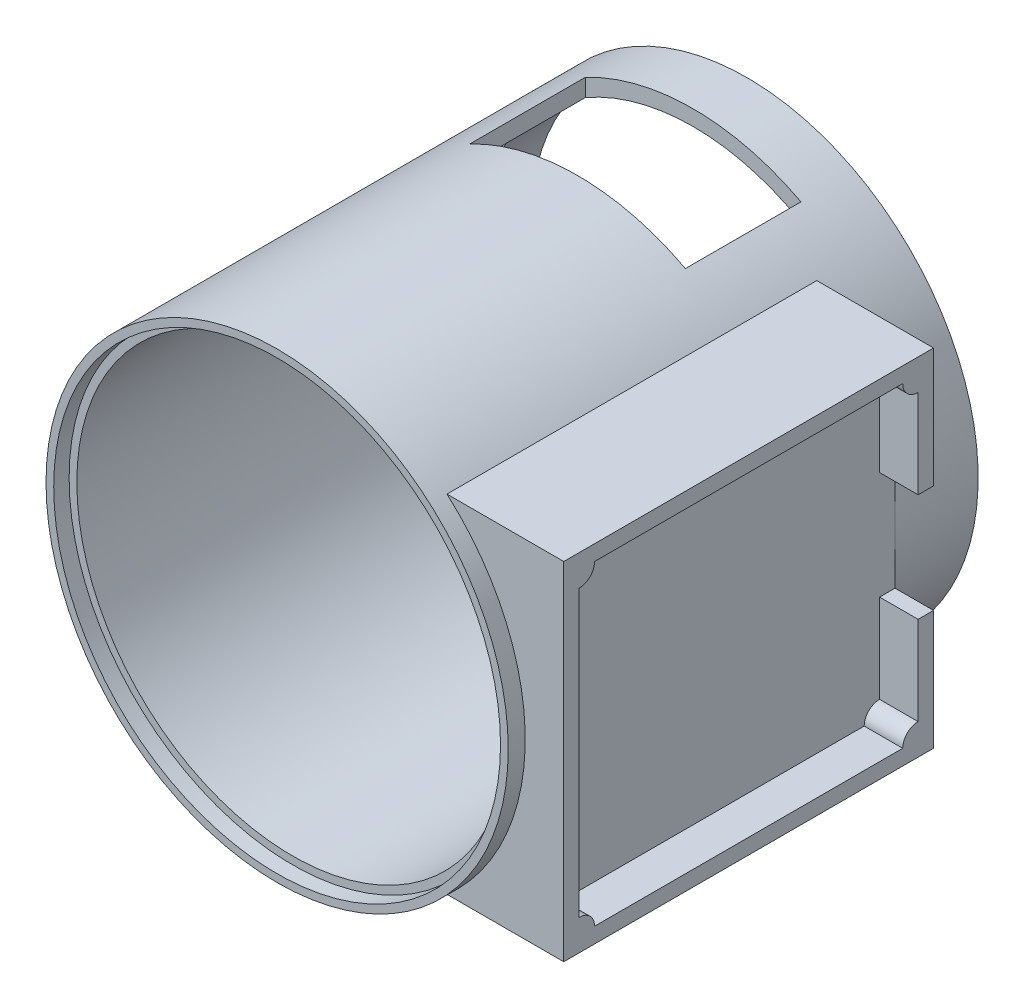
from build123d import *
from build123d.topology import SkipClean

# Parameters (mm, degrees)
SKETCH_1_R               = 30
SKETCH_1_R_2             = 28
EXTRUDE_1_DEPTH          = 2
SKETCH_2_R               = 30
SKETCH_2_R_2             = 28
EXTRUDE_2_DEPTH          = 52
CUT_EXTRUDE_START        = -2
SKETCH_6_R               = 29
SKETCH_6_R_2             = 28
CUT_EXTRUDE_2_DEPTH      = 2
EXTRUDE_START            = 7
SKETCH_7_R               = 30
SKETCH_7_R_2             = 28
EXTRUDE_3_DEPTH          = 7
EXTRUDE_7_REACH          = 88.116
EXTRUDE_7_END_RADIUS     = 30
SKETCH_8_W               = 48
SKETCH_8_H               = 45
SKETCH_9_W               = 28
SKETCH_9_H               = 15
CUT_EXTRUDE_3_DEPTH      = 69.673138854
PATTERN_CIRCULAR_2_COUNT = 3
PATTERN_CIRCULAR_2_ANGLE = 180
EXTRUDE_8_DEPTH          = 5


with BuildPart() as part:
    # 草图1 → 凸台-拉伸1 (new body)
    with BuildSketch(Plane.XY):
        Circle(SKETCH_1_R)
        Circle(SKETCH_1_R_2, mode=Mode.SUBTRACT)
    extrude(amount=EXTRUDE_1_DEPTH)

    # 草图2 → 凸台-拉伸2 (add)
    with BuildSketch(Plane.XY.offset(2)):
        Circle(SKETCH_2_R)
        Circle(SKETCH_2_R_2, mode=Mode.SUBTRACT)
    extrude(amount=EXTRUDE_2_DEPTH)

    # 草图6 → 切除-拉伸2 (cut)
    with BuildSketch(Plane.XY.offset(54).offset(CUT_EXTRUDE_START)):
        Circle(SKETCH_6_R)
        Circle(SKETCH_6_R_2, mode=Mode.SUBTRACT)
    extrude(amount=CUT_EXTRUDE_2_DEPTH, mode=Mode.SUBTRACT)

    # 草图7 → 凸台-拉伸3 (add)
    with SkipClean():  # the faces are left unmerged after this step: merging them gives an invalid solid
        with BuildSketch(Plane(origin=(0, 0, 0), x_dir=(-1, 0, 0), z_dir=(0, 0, -1)).offset(EXTRUDE_START)):
            Circle(SKETCH_7_R)
            Circle(SKETCH_7_R_2, mode=Mode.SUBTRACT)
        extrude(amount=-EXTRUDE_3_DEPTH)

    # 凸台-拉伸7: up to this cylinder (the profile starts outside it)
    with SkipClean():  # the faces are left unmerged after this step: merging them gives an invalid solid
        extrude_7_end = Plane(origin=(0, 0, 27.794079), z_dir=(0, 0, -1)) * Cylinder(EXTRUDE_7_END_RADIUS, 237.232, mode=Mode.PRIVATE)
        # 草图8 → 凸台-拉伸7 (add, up to the surface)
        with BuildSketch(Plane(origin=(30, 0, 0), x_dir=(0, 0, -1), z_dir=(1, 0, 0)), mode=Mode.PRIVATE) as extrude_7_sk1:
            with Locations((-27.794078809, 0)):
                Rectangle(SKETCH_8_W, SKETCH_8_H)
        extrude_7_tool1 = extrude(extrude_7_sk1.sketch, amount=-EXTRUDE_7_REACH, mode=Mode.PRIVATE) - extrude_7_end
        add(extrude_7_tool1.solids().sort_by_distance((30, 0, 27.794079))[0])
        add(extrude_7_tool1.solids().sort_by_distance((30, 0, 27.794079))[1])

    # 草图9 → 切除-拉伸3 (cut, through all)
    with SkipClean():  # the faces are left unmerged after this step: merging them gives an invalid solid
        with BuildSketch(Plane(origin=(0, 0, 0), x_dir=(1, 0, 0), z_dir=(0, 1, 0))):
            with Locations((0, -7.5)):
                Rectangle(SKETCH_9_W, SKETCH_9_H)
        cut_extrude_3 = extrude(amount=-CUT_EXTRUDE_3_DEPTH, mode=Mode.SUBTRACT)

    # 阵列(圆周)2: 切除-拉伸3 ×3 about axis
    with SkipClean():  # the faces are left unmerged after this step: merging them gives an invalid solid
        pattern_circular_2_axis = Axis((0, 0, 0), (0, 0, -1))
        for i in range(1, PATTERN_CIRCULAR_2_COUNT):
            add(cut_extrude_3.rotate(pattern_circular_2_axis, i * PATTERN_CIRCULAR_2_ANGLE / (PATTERN_CIRCULAR_2_COUNT - 1)), mode=Mode.SUBTRACT)

    # 草图10 → 凸台-拉伸8 (add)
    with SkipClean():  # the faces are left unmerged after this step: merging them gives an invalid solid
        with BuildSketch(Plane(origin=(30, 0, 0), x_dir=(0, 0, -1), z_dir=(1, 0, 0))):
            with BuildLine():
                Line((-3.794078809, 22.5), (-3.794078809, 7))
                Line((-3.794078809, 7), (-5.794078809, 7))
                Line((-5.794078809, 7), (-5.794078809, 18.5))
                ThreePointArc((-5.794078809, 18.5), (-7.208292371, 19.085786438), (-7.794078809, 20.5))
                Line((-7.794078809, 20.5), (-47.794078809, 20.5))
                ThreePointArc((-47.794078809, 20.5), (-48.379865247, 19.085786438), (-49.794078809, 18.5))
                Line((-49.794078809, 18.5), (-49.794078809, -18.5))
                ThreePointArc((-49.794078809, -18.5), (-48.379865247, -19.085786438), (-47.794078809, -20.5))
                Line((-47.794078809, -20.5), (-7.794078809, -20.5))
                ThreePointArc((-7.794078809, -20.5), (-7.208292371, -19.085786438), (-5.794078809, -18.5))
                Line((-5.794078809, -18.5), (-5.794078809, -7))
                Line((-5.794078809, -7), (-3.794078809, -7))
                Line((-3.794078809, -7), (-3.794078809, -22.5))
                Line((-3.794078809, -22.5), (-51.794078809, -22.5))
                Line((-51.794078809, -22.5), (-51.794078809, 22.5))
                Line((-51.794078809, 22.5), (-3.794078809, 22.5))
            make_face()
        extrude(amount=EXTRUDE_8_DEPTH)


solid = part.part
